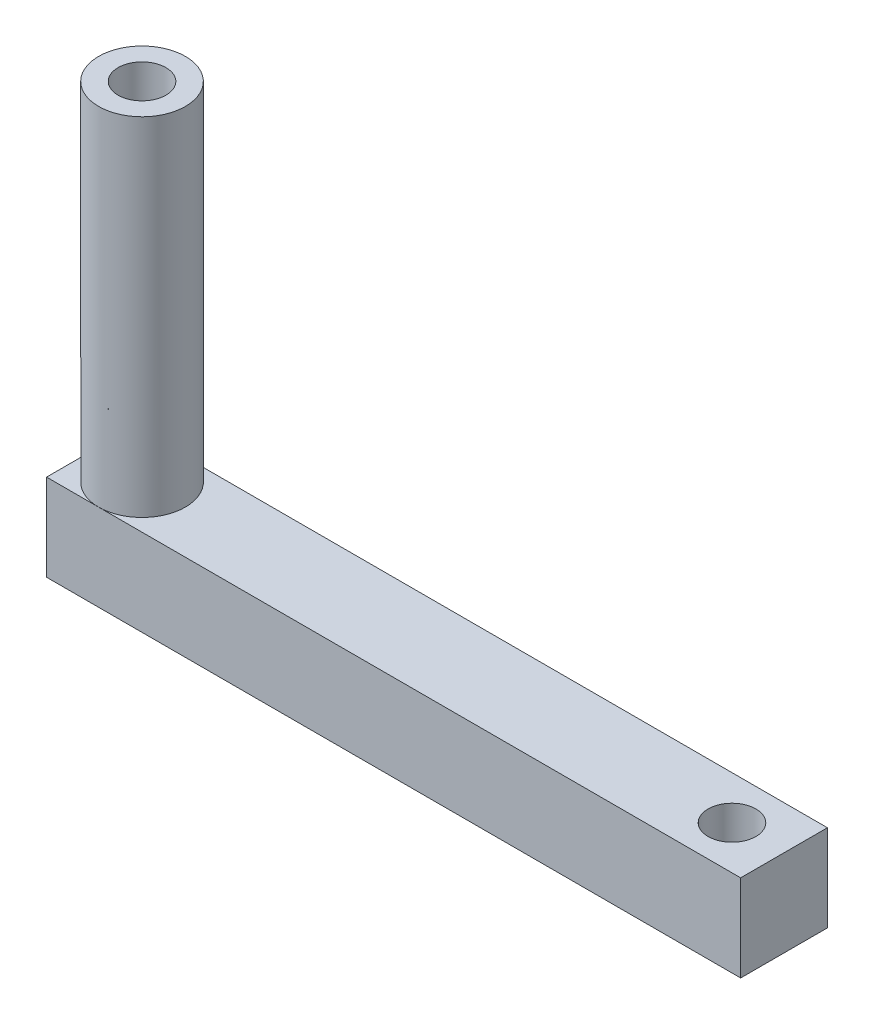
from build123d import *

# Parameters (mm, degrees)
SKETCH1_W           = 50.8
SKETCH1_H           = 6.35
SKETCH1_R           = 1.75
BOSS_EXTRUDE1_DEPTH = 6.35
BOSS_EXTRUDE2_START = -31.75
SKETCH2_R           = 3.175
SKETCH2_R_2         = 1.75
BOSS_EXTRUDE2_DEPTH = 25.4


with BuildPart() as part:
    # Sketch1 → Boss-Extrude1 (new body)
    with BuildSketch(Plane(origin=(0, 0, 0), x_dir=(1, 0, 0), z_dir=(0, 1, 0))):
        with Locations((25.4, 3.175)):
            Rectangle(SKETCH1_W, SKETCH1_H)
        with Locations((3.81, 3.175)):
            Circle(SKETCH1_R, mode=Mode.SUBTRACT)
        with Locations((46.99, 3.175)):
            Circle(SKETCH1_R, mode=Mode.SUBTRACT)
    extrude(amount=-BOSS_EXTRUDE1_DEPTH)

    # Sketch2 → Boss-Extrude2 (add)
    with BuildSketch(Plane.XZ.offset(6.35).offset(BOSS_EXTRUDE2_START)):
        with Locations((3.81, -3.175)):
            Circle(SKETCH2_R)
        with Locations((3.81, -3.175)):
            Circle(SKETCH2_R_2, mode=Mode.SUBTRACT)
    extrude(amount=BOSS_EXTRUDE2_DEPTH)


solid = part.part
